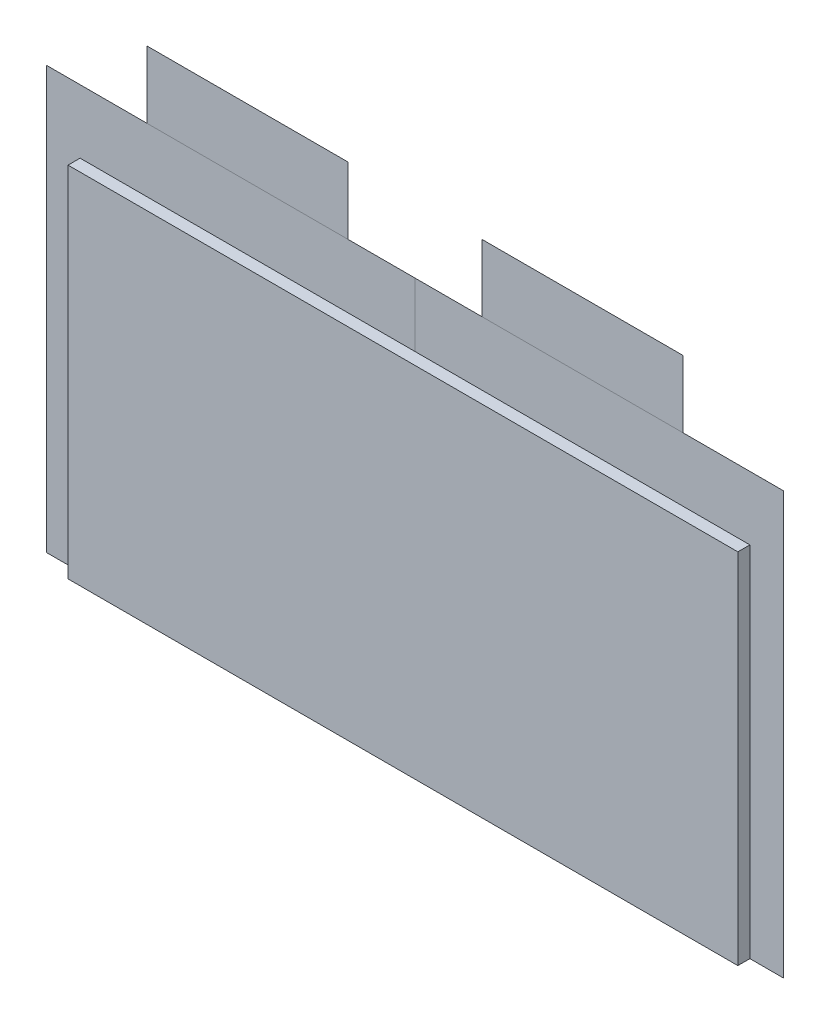
from build123d import *

# Parameters (mm, degrees)
BOSS_EXTRUDE1_DEPTH   = 3.6
MINUS_ISOLATION_START = -5e-05
MINUS_ISOLATION_DEPTH = 0.0001
PLUS_ISOLATION_DEPTH  = 5e-05
SKETCH1_4_W           = 60
SKETCH1_4_H           = 20
PLUS_DEPTH            = 5e-05
SKETCH1_5_W           = 60
SKETCH1_5_H           = 20
MINUS_DEPTH           = 5e-05


# Read off the part's stored shape, not the designer's step: minus_isolation
with BuildPart() as part:
    # Sketch1 → Boss-Extrude1 (new, symmetric)
    with BuildSketch(Plane.XY):
        Polygon((-100, 53.5), (-100, -53.5), (100, -53.5), (100, 53.5), (0, 53.5), align=None)
    extrude(amount=BOSS_EXTRUDE1_DEPTH, both=True)


with BuildPart() as body_2:
    # minus_isolation outline → minus_isolation (new body)
    with BuildSketch(Plane.XY.offset(MINUS_ISOLATION_START)):
        Polygon((110, -53.5), (110, 72.5), (0, 72.5), (0, 53.5), (100, 53.5), (100, -53.5), align=None)
    extrude(amount=MINUS_ISOLATION_DEPTH)


with BuildPart() as body_3:
    # Sketch1<6> → plus_isolation (new, symmetric)
    with BuildSketch(Plane.XY):
        Polygon((-110, 72.5), (-110, -53.5), (-100, -53.5), (-100, 53.5), (0, 53.5), (0, 72.5), (-20, 72.5), (-80, 72.5), align=None)
    extrude(amount=PLUS_ISOLATION_DEPTH, both=True)


with BuildPart() as body_4:
    # Sketch1<4> → plus (new, symmetric)
    with BuildSketch(Plane.XY):
        with Locations((-50, 82.5)):
            Rectangle(SKETCH1_4_W, SKETCH1_4_H)
    extrude(amount=PLUS_DEPTH, both=True)


with BuildPart() as body_5:
    # Sketch1<5> → minus (new, symmetric)
    with BuildSketch(Plane.XY):
        with Locations((50, 82.5)):
            Rectangle(SKETCH1_5_W, SKETCH1_5_H)
    extrude(amount=MINUS_DEPTH, both=True)


solid = Compound([part.part, body_2.part, body_3.part, body_4.part, body_5.part])
